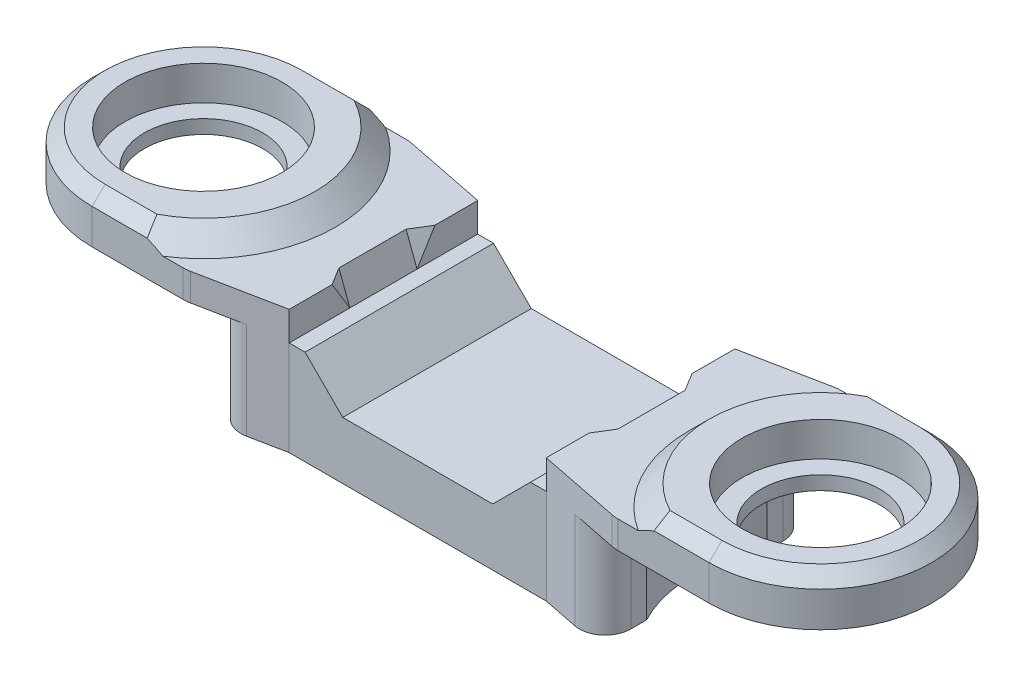
from build123d import *
from OCP.BRepFilletAPI import BRepFilletAPI_MakeChamfer

# Parameters (mm, degrees)
SKETCH1_W               = 15
SKETCH1_H               = 11
BOSS_EXTRUDE1_DEPTH     = 5.545
BOSS_EXTRUDE2_DEPTH     = 7.245
SKETCH1_6_R             = 6.5
SKETCH1_6_R_2           = 4.58
BOSS_EXTRUDE3_DEPTH     = 8.445
SKETCH1_7_R             = 4.58
SKETCH1_7_R_2           = 3.45
BOSS_EXTRUDE4_DEPTH     = 6.445
SKETCH1_8_R             = 6.5
SKETCH1_8_R_2           = 4.58
SKETCH1_8_R_3           = 3.45
CUT_EXTRUDE1_DEPTH      = 5.645
CUT_EXTRUDE2_DEPTH      = 3
CUT_EXTRUDE3_DEPTH      = 27.717373093
CUT_EXTRUDE3_DEPTH_BACK = 27.717373093
SKETCH2_4_W             = 8.75
SKETCH2_4_H             = 2.2
CHAMFER1_SIZE           = 1.039230485
CHAMFER1_SIZE_2         = 0.6
CHAMFER2_SIZE           = 2.2
CHAMFER3_SIZE           = 0.75
CHAMFER4_SIZE           = 1.2
FILLET1_R               = 2
FILLET2_R               = 1.5


with BuildPart() as part:
    # Sketch1 → Boss-Extrude1 (new body)
    with BuildSketch(Plane(origin=(0, 0, 0), x_dir=(1, 0, 0), z_dir=(0, 1, 0))):
        Rectangle(SKETCH1_W, SKETCH1_H)
    extrude(amount=BOSS_EXTRUDE1_DEPTH)

    # Sketch1<5> → Boss-Extrude2 (add)
    with BuildSketch(Plane(origin=(0, 0, 0), x_dir=(1, 0, 0), z_dir=(0, 1, 0))):
        with BuildLine():
            Line((-12.5, 6.5), (-13.872046512, 6.5))
            ThreePointArc((-13.872046512, 6.5), (-12.47142118, 5.359553734), (-11.375, 3.924203741))
            Line((-11.375, 3.924203741), (-11.375, 6.275))
            Line((-11.375, 6.275), (-12.5, 6.5))
        make_face()
        with BuildLine():
            Line((-11.375, 6.275), (-11.375, 3.924203741))
            ThreePointArc((-11.375, 3.924203741), (-10.3, 0), (-11.375, -3.924203741))
            Line((-11.375, -3.924203741), (-11.375, -6.275))
            Line((-11.375, -6.275), (-7.5, -5.5))
            Line((-7.5, -5.5), (-7.5, 5.5))
            Line((-7.5, 5.5), (-11.375, 6.275))
        make_face()
        with BuildLine():
            ThreePointArc((-11.375, -3.924203741), (-12.47142118, -5.359553734), (-13.872046512, -6.5))
            Line((-13.872046512, -6.5), (-12.5, -6.5))
            Line((-12.5, -6.5), (-11.375, -6.275))
            Line((-11.375, -6.275), (-11.375, -3.924203741))
        make_face()
        with BuildLine():
            Line((12.5, 6.5), (11.375, 6.275))
            Line((11.375, 6.275), (11.375, 3.924203741))
            ThreePointArc((11.375, 3.924203741), (12.47142118, 5.359553734), (13.872046512, 6.5))
            Line((13.872046512, 6.5), (12.5, 6.5))
        make_face()
        with BuildLine():
            Line((11.375, 6.275), (7.5, 5.5))
            Line((7.5, 5.5), (7.5, -5.5))
            Line((7.5, -5.5), (11.375, -6.275))
            Line((11.375, -6.275), (11.375, -3.924203741))
            ThreePointArc((11.375, -3.924203741), (10.3, 0), (11.375, 3.924203741))
            Line((11.375, 3.924203741), (11.375, 6.275))
        make_face()
        with BuildLine():
            Line((11.375, -3.924203741), (11.375, -6.275))
            Line((11.375, -6.275), (12.5, -6.5))
            Line((12.5, -6.5), (13.872046512, -6.5))
            ThreePointArc((13.872046512, -6.5), (12.47142118, -5.359553734), (11.375, -3.924203741))
        make_face()
    extrude(amount=BOSS_EXTRUDE2_DEPTH)

    # Sketch1<6> → Boss-Extrude3 (add)
    # profile 1 of 6: a face of its own
    with BuildSketch(Plane(origin=(0, 0, 0), x_dir=(1, 0, 0), z_dir=(0, 1, 0))):
        with BuildLine():
            Line((-13.872046512, 6.5), (-18, 6.5))
            ThreePointArc((-18, 6.5), (-13.403805922, 4.596194078), (-11.5, 0))
            ThreePointArc((-11.5, 0), (-13.403805922, -4.596194078), (-18, -6.5))
            Line((-18, -6.5), (-13.872046512, -6.5))
            ThreePointArc((-13.872046512, -6.5), (-12.47142118, -5.359553734), (-11.375, -3.924203741))
            Line((-11.375, -3.924203741), (-11.375, -3.515590278))
            ThreePointArc((-11.375, -3.515590278), (-10.5, 0), (-11.375, 3.515590278))
            Line((-11.375, 3.515590278), (-11.375, 3.924203741))
            ThreePointArc((-11.375, 3.924203741), (-12.47142118, 5.359553734), (-13.872046512, 6.5))
        make_face()
    # profile 2 of 6: a face of its own
    with BuildSketch(Plane(origin=(0, 0, 0), x_dir=(1, 0, 0), z_dir=(0, 1, 0))):
        with Locations((-18, 0)):
            Circle(SKETCH1_6_R)
        with Locations(Location((-18, 0, 0), (0, 0, 270))):
            Circle(SKETCH1_6_R_2, mode=Mode.SUBTRACT)
    # profile 3 of 6: a face of its own
    with BuildSketch(Plane(origin=(0, 0, 0), x_dir=(1, 0, 0), z_dir=(0, 1, 0))):
        with BuildLine():
            ThreePointArc((13.872046512, 6.5), (12.47142118, 5.359553734), (11.375, 3.924203741))
            Line((11.375, 3.924203741), (11.375, 3.515590278))
            ThreePointArc((11.375, 3.515590278), (10.5, 0), (11.375, -3.515590278))
            Line((11.375, -3.515590278), (11.375, -3.924203741))
            ThreePointArc((11.375, -3.924203741), (12.47142118, -5.359553734), (13.872046512, -6.5))
            Line((13.872046512, -6.5), (18, -6.5))
            ThreePointArc((18, -6.5), (11.5, 0), (18, 6.5))
            Line((18, 6.5), (13.872046512, 6.5))
        make_face()
    # profile 4 of 6: a face of its own
    with BuildSketch(Plane(origin=(0, 0, 0), x_dir=(1, 0, 0), z_dir=(0, 1, 0))):
        with Locations((18, 0)):
            Circle(SKETCH1_6_R)
        with Locations(Location((18, 0, 0), (0, 0, 270))):
            Circle(SKETCH1_6_R_2, mode=Mode.SUBTRACT)
    # profile 5 of 6: a face of its own
    with BuildSketch(Plane(origin=(0, 0, 0), x_dir=(1, 0, 0), z_dir=(0, 1, 0))):
        with BuildLine():
            Line((11.375, 3.515590278), (11.375, 3.924203741))
            ThreePointArc((11.375, 3.924203741), (10.3, 0), (11.375, -3.924203741))
            Line((11.375, -3.924203741), (11.375, -3.515590278))
            ThreePointArc((11.375, -3.515590278), (10.5, 0), (11.375, 3.515590278))
        make_face()
    # profile 6 of 6: a face of its own
    with BuildSketch(Plane(origin=(0, 0, 0), x_dir=(1, 0, 0), z_dir=(0, 1, 0))):
        with BuildLine():
            ThreePointArc((-11.375, -3.924203741), (-10.3, 0), (-11.375, 3.924203741))
            Line((-11.375, 3.924203741), (-11.375, 3.515590278))
            ThreePointArc((-11.375, 3.515590278), (-10.5, 0), (-11.375, -3.515590278))
            Line((-11.375, -3.515590278), (-11.375, -3.924203741))
        make_face()
    extrude(amount=BOSS_EXTRUDE3_DEPTH)

    # Sketch1<7> → Boss-Extrude4 (add)
    # profile 1 of 2: a face of its own
    with BuildSketch(Plane(origin=(0, 0, 0), x_dir=(1, 0, 0), z_dir=(0, 1, 0))):
        with Locations(Location((-18, 0, 0), (0, 0, 270))):
            Circle(SKETCH1_7_R)
        with Locations(Location((-18, 0, 0), (0, 0, 270))):
            Circle(SKETCH1_7_R_2, mode=Mode.SUBTRACT)
    # profile 2 of 2: a face of its own
    with BuildSketch(Plane(origin=(0, 0, 0), x_dir=(1, 0, 0), z_dir=(0, 1, 0))):
        with Locations(Location((18, 0, 0), (0, 0, 270))):
            Circle(SKETCH1_7_R)
        with Locations(Location((18, 0, 0), (0, 0, 270))):
            Circle(SKETCH1_7_R_2, mode=Mode.SUBTRACT)
    extrude(amount=BOSS_EXTRUDE4_DEPTH)

    # Sketch1<8> → Cut-Extrude1 (cut)
    # profile 1 of 10: a face of its own
    with BuildSketch(Plane(origin=(0, 0, 0), x_dir=(1, 0, 0), z_dir=(0, 1, 0))):
        with Locations((-18, 0)):
            Circle(SKETCH1_8_R)
        with Locations(Location((-18, 0, 0), (0, 0, 270))):
            Circle(SKETCH1_8_R_2, mode=Mode.SUBTRACT)
    # profile 2 of 10: a face of its own
    with BuildSketch(Plane(origin=(0, 0, 0), x_dir=(1, 0, 0), z_dir=(0, 1, 0))):
        with Locations(Location((-18, 0, 0), (0, 0, 270))):
            Circle(SKETCH1_8_R_2)
        with Locations(Location((-18, 0, 0), (0, 0, 270))):
            Circle(SKETCH1_8_R_3, mode=Mode.SUBTRACT)
    # profile 3 of 10: a face of its own
    with BuildSketch(Plane(origin=(0, 0, 0), x_dir=(1, 0, 0), z_dir=(0, 1, 0))):
        with BuildLine():
            Line((-13.872046512, 6.5), (-18, 6.5))
            ThreePointArc((-18, 6.5), (-13.403805922, 4.596194078), (-11.5, 0))
            ThreePointArc((-11.5, 0), (-13.403805922, -4.596194078), (-18, -6.5))
            Line((-18, -6.5), (-13.872046512, -6.5))
            ThreePointArc((-13.872046512, -6.5), (-12.47142118, -5.359553734), (-11.375, -3.924203741))
            Line((-11.375, -3.924203741), (-11.375, -3.515590278))
            ThreePointArc((-11.375, -3.515590278), (-10.5, 0), (-11.375, 3.515590278))
            Line((-11.375, 3.515590278), (-11.375, 3.924203741))
            ThreePointArc((-11.375, 3.924203741), (-12.47142118, 5.359553734), (-13.872046512, 6.5))
        make_face()
    # profile 4 of 10: a face of its own
    with BuildSketch(Plane(origin=(0, 0, 0), x_dir=(1, 0, 0), z_dir=(0, 1, 0))):
        with BuildLine():
            Line((-12.5, 6.5), (-13.872046512, 6.5))
            ThreePointArc((-13.872046512, 6.5), (-12.47142118, 5.359553734), (-11.375, 3.924203741))
            Line((-11.375, 3.924203741), (-11.375, 6.275))
            Line((-11.375, 6.275), (-12.5, 6.5))
        make_face()
    # profile 5 of 10: a face of its own
    with BuildSketch(Plane(origin=(0, 0, 0), x_dir=(1, 0, 0), z_dir=(0, 1, 0))):
        with BuildLine():
            ThreePointArc((-11.375, -3.924203741), (-12.47142118, -5.359553734), (-13.872046512, -6.5))
            Line((-13.872046512, -6.5), (-12.5, -6.5))
            Line((-12.5, -6.5), (-11.375, -6.275))
            Line((-11.375, -6.275), (-11.375, -3.924203741))
        make_face()
    # profile 6 of 10: a face of its own
    with BuildSketch(Plane(origin=(0, 0, 0), x_dir=(1, 0, 0), z_dir=(0, 1, 0))):
        with BuildLine():
            Line((12.5, 6.5), (11.375, 6.275))
            Line((11.375, 6.275), (11.375, 3.924203741))
            ThreePointArc((11.375, 3.924203741), (12.47142118, 5.359553734), (13.872046512, 6.5))
            Line((13.872046512, 6.5), (12.5, 6.5))
        make_face()
    # profile 7 of 10: a face of its own
    with BuildSketch(Plane(origin=(0, 0, 0), x_dir=(1, 0, 0), z_dir=(0, 1, 0))):
        with BuildLine():
            Line((11.375, -3.924203741), (11.375, -6.275))
            Line((11.375, -6.275), (12.5, -6.5))
            Line((12.5, -6.5), (13.872046512, -6.5))
            ThreePointArc((13.872046512, -6.5), (12.47142118, -5.359553734), (11.375, -3.924203741))
        make_face()
    # profile 8 of 10: a face of its own
    with BuildSketch(Plane(origin=(0, 0, 0), x_dir=(1, 0, 0), z_dir=(0, 1, 0))):
        with BuildLine():
            ThreePointArc((13.872046512, 6.5), (12.47142118, 5.359553734), (11.375, 3.924203741))
            Line((11.375, 3.924203741), (11.375, 3.515590278))
            ThreePointArc((11.375, 3.515590278), (10.5, 0), (11.375, -3.515590278))
            Line((11.375, -3.515590278), (11.375, -3.924203741))
            ThreePointArc((11.375, -3.924203741), (12.47142118, -5.359553734), (13.872046512, -6.5))
            Line((13.872046512, -6.5), (18, -6.5))
            ThreePointArc((18, -6.5), (11.5, 0), (18, 6.5))
            Line((18, 6.5), (13.872046512, 6.5))
        make_face()
    # profile 9 of 10: a face of its own
    with BuildSketch(Plane(origin=(0, 0, 0), x_dir=(1, 0, 0), z_dir=(0, 1, 0))):
        with Locations((18, 0)):
            Circle(SKETCH1_8_R)
        with Locations(Location((18, 0, 0), (0, 0, 270))):
            Circle(SKETCH1_8_R_2, mode=Mode.SUBTRACT)
    # profile 10 of 10: a face of its own
    with BuildSketch(Plane(origin=(0, 0, 0), x_dir=(1, 0, 0), z_dir=(0, 1, 0))):
        with Locations(Location((18, 0, 0), (0, 0, 270))):
            Circle(SKETCH1_8_R_2)
        with Locations(Location((18, 0, 0), (0, 0, 270))):
            Circle(SKETCH1_8_R_3, mode=Mode.SUBTRACT)
    extrude(amount=CUT_EXTRUDE1_DEPTH, mode=Mode.SUBTRACT)

    # Sketch2 → Cut-Extrude2 (cut, symmetric)
    with BuildSketch(Plane.XY):
        Polygon((-7.5, 5.545), (-8.141268506, 7.245), (-7.5, 7.245), align=None)
        Polygon((7.5, 5.545), (8.141268506, 7.245), (7.5, 7.245), align=None)
    extrude(amount=CUT_EXTRUDE2_DEPTH, both=True, mode=Mode.SUBTRACT)

    # Sketch2<4> → Cut-Extrude3 (cut, two sides: drawn at the far end of the back side and taken through both)
    with BuildSketch(Plane.XY.offset(-CUT_EXTRUDE3_DEPTH_BACK)):
        with Locations((0, 4.445)):
            Rectangle(SKETCH2_4_W, SKETCH2_4_H)
    extrude(amount=CUT_EXTRUDE3_DEPTH + CUT_EXTRUDE3_DEPTH_BACK, mode=Mode.SUBTRACT)

    # Chamfer1
    chamfer1_edges_1 = [part.edges().sort_by_distance(p)[0] for p in [
        (7.820634253, 6.395, 3),
    ]]
    chamfer1_side_1 = [part.faces().sort_by_distance(p)[0] for p in [
        (7.820634253, 6.395, 2.988),
    ]]
    chamfer1_edges_2 = [part.edges().sort_by_distance(p)[0] for p in [
        (7.820634253, 6.395, -3),
    ]]
    chamfer1_side_2 = [part.faces().sort_by_distance(p)[0] for p in [
        (7.820634253, 6.395, -2.988),
    ]]
    chamfer1_edges_3 = [part.edges().sort_by_distance(p)[0] for p in [
        (-7.820634253, 6.395, 3),
    ]]
    chamfer1_side_3 = [part.faces().sort_by_distance(p)[0] for p in [
        (-7.820634253, 6.395, 2.988),
    ]]
    chamfer1_edges_4 = [part.edges().sort_by_distance(p)[0] for p in [
        (-7.820634253, 6.395, -3),
    ]]
    chamfer1_side_4 = [part.faces().sort_by_distance(p)[0] for p in [
        (-7.820634253, 6.395, -2.988),
    ]]
    chamfer1 = BRepFilletAPI_MakeChamfer(part.part.solid().wrapped)
    for e in chamfer1_edges_1:
        chamfer1.Add(CHAMFER1_SIZE - 0.0001, CHAMFER1_SIZE_2 - 0.0001, e.wrapped, chamfer1_side_1[0].wrapped)
    for e in chamfer1_edges_2:
        chamfer1.Add(CHAMFER1_SIZE - 0.0001, CHAMFER1_SIZE_2 - 0.0001, e.wrapped, chamfer1_side_2[0].wrapped)
    for e in chamfer1_edges_3:
        chamfer1.Add(CHAMFER1_SIZE - 0.0001, CHAMFER1_SIZE_2 - 0.0001, e.wrapped, chamfer1_side_3[0].wrapped)
    for e in chamfer1_edges_4:
        chamfer1.Add(CHAMFER1_SIZE - 0.0001, CHAMFER1_SIZE_2 - 0.0001, e.wrapped, chamfer1_side_4[0].wrapped)
    add(Compound.cast(chamfer1.Shape()), mode=Mode.REPLACE)  # a hair under: the kernel refuses the full size

    # Chamfer2
    chamfer2_edges = [part.edges().sort_by_distance(p)[0] for p in [
        (4.375, 5.545, 0),
        (-4.375, 5.545, 0),
    ]]
    chamfer(chamfer2_edges, length=CHAMFER2_SIZE - 0.0001)  # a hair under: the kernel refuses the full size

    # Chamfer3
    chamfer3_edges = [part.edges().sort_by_distance(p)[0] for p in [
        (15.936023256, 8.445, 6.5),
        (24.5, 8.445, 0),
        (15.936023256, 8.445, -6.5),
        (-15.936023256, 8.445, -6.5),
        (-24.5, 8.445, 0),
        (-15.936023256, 8.445, 6.5),
    ]]
    chamfer(chamfer3_edges, length=CHAMFER3_SIZE)

    # Chamfer4
    chamfer4_edges = [part.edges().sort_by_distance(p)[0] for p in [
        (-10.3, 8.445, 0),
        (10.3, 8.445, 0),
    ]]
    chamfer(chamfer4_edges, length=CHAMFER4_SIZE - 0.0001)  # a hair under: the kernel refuses the full size

    # Fillet1
    fillet1_edges = [part.edges().sort_by_distance(p)[0] for p in [
        (-12.5, 6.445, 6.5),
        (-12.5, 6.445, -6.5),
        (12.5, 6.445, -6.5),
        (12.5, 6.445, 6.5),
    ]]
    fillet(fillet1_edges, radius=FILLET1_R)

    # Fillet2
    fillet2_edges = [part.edges().sort_by_distance(p)[0] for p in [
        (-11.375, 2.8225, 6.275),
        (-11.375, 2.8225, -6.275),
        (11.375, 2.8225, -6.275),
        (11.375, 2.8225, 6.275),
    ]]
    fillet(fillet2_edges, radius=FILLET2_R)


solid = part.part
